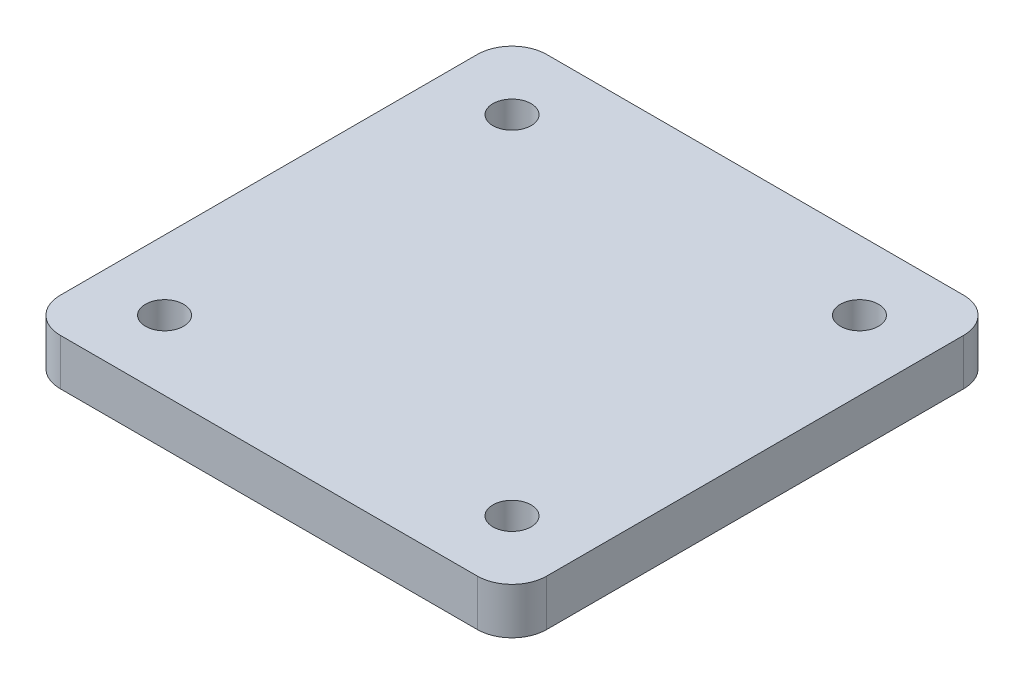
from build123d import *

# Parameters (mm, degrees)
SKETCH_1_W          = 42
SKETCH_1_H          = 4
BLOCKEXTRUDE_DEPTH  = 42
FILLET_2_R          = 3
SKETCH_2_R          = 1.65
MOUNT_HOLE_DEPTH    = 60.531504265
SKETCH_3_R          = 1.65
CUT_EXTRUDE_2_DEPTH = 60.531504265
SKETCH_4_R          = 1.65
CUT_EXTRUDE_3_DEPTH = 60.531504265
SKETCH_5_R          = 1.65
CUT_EXTRUDE_4_DEPTH = 60.531504265


with BuildPart() as part:
    # 草图1 → BlockExtrude (new body)
    with BuildSketch(Plane.XY):
        with Locations((21, 2)):
            Rectangle(SKETCH_1_W, SKETCH_1_H)
    extrude(amount=BLOCKEXTRUDE_DEPTH)

    # Fillet 2
    fillet_2_edges = [part.edges().sort_by_distance(p)[0] for p in [
        (0, 2, 0),
        (42, 2, 0),
        (0, 2, 42),
        (42, 2, 42),
    ]]
    fillet(fillet_2_edges, radius=FILLET_2_R)

    # 草图2 → Mount_hole (cut, through all)
    with BuildSketch(Plane(origin=(0, 4, 0), x_dir=(1, 0, 0), z_dir=(0, 1, 0))):
        with Locations((6, -6)):
            Circle(SKETCH_2_R)
    extrude(amount=-MOUNT_HOLE_DEPTH, mode=Mode.SUBTRACT)

    # 草图3 → 切除-拉伸2 (cut, through all)
    with BuildSketch(Plane(origin=(0, 4, 0), x_dir=(1, 0, 0), z_dir=(0, 1, 0))):
        with Locations((6, -36)):
            Circle(SKETCH_3_R)
    extrude(amount=-CUT_EXTRUDE_2_DEPTH, mode=Mode.SUBTRACT)

    # 草图4 → 切除-拉伸3 (cut, through all)
    with BuildSketch(Plane(origin=(0, 4, 0), x_dir=(1, 0, 0), z_dir=(0, 1, 0))):
        with Locations((36, -6)):
            Circle(SKETCH_4_R)
    extrude(amount=-CUT_EXTRUDE_3_DEPTH, mode=Mode.SUBTRACT)

    # 草图5 → 切除-拉伸4 (cut, through all)
    with BuildSketch(Plane(origin=(0, 4, 0), x_dir=(1, 0, 0), z_dir=(0, 1, 0))):
        with Locations((36, -36)):
            Circle(SKETCH_5_R)
    extrude(amount=-CUT_EXTRUDE_4_DEPTH, mode=Mode.SUBTRACT)


solid = part.part
